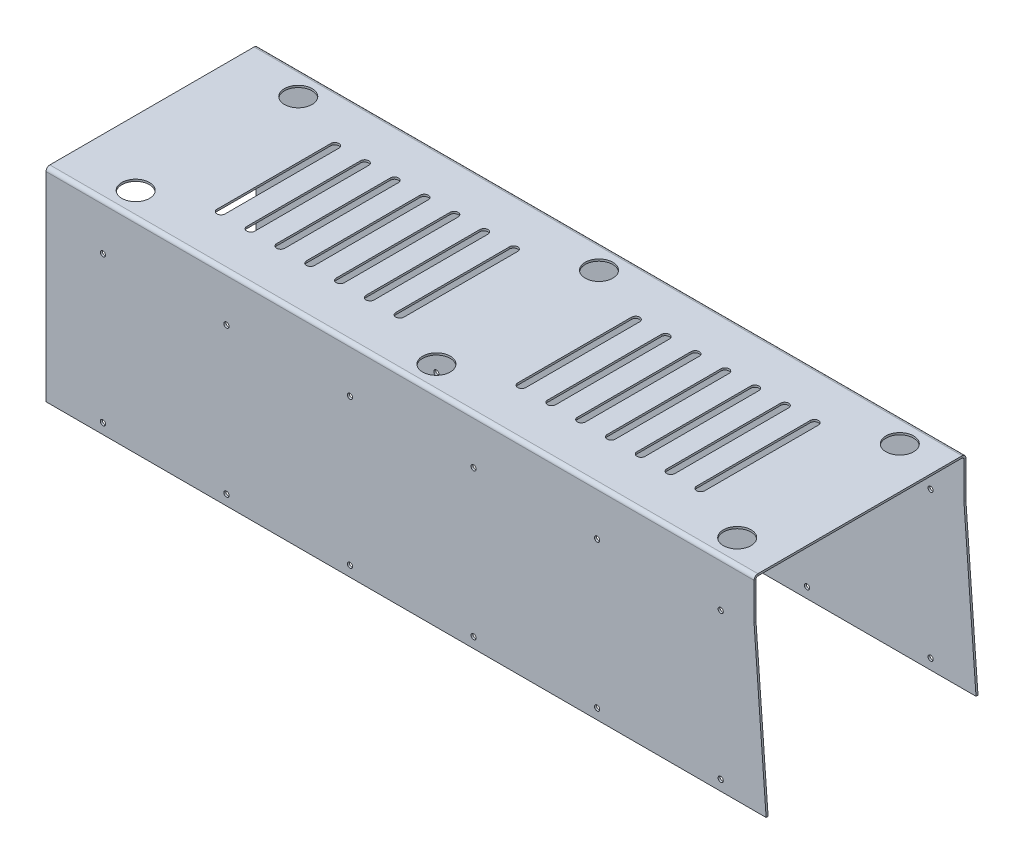
from build123d import *

# Parameters (mm, degrees)
SKETCH1_W               = 450
SKETCH1_H               = 125.6
BOSS_EXTRUDE1_DEPTH     = 1.22
EDGE_FLANGE1_DEPTH      = 450
EDGE_FLANGE1_BEND_DEPTH = 450
CUT_EXTRUDE1_DEPTH      = 265.939058972
CUT_EXTRUDE1_DEPTH_BACK = 265.939058972
CUT_EXTRUDE4_REACH      = 267.511
SKETCH15_R              = 8.5
CUT_EXTRUDE5_DEPTH      = 265.939058972
CUT_EXTRUDE5_DEPTH_BACK = 265.939058972
SKETCH16_R              = 1.6
CUT_EXTRUDE6_REACH      = 267.511


# Sheet-metal steps are written as plain solids
with BuildPart() as part:
    # Sketch1 → Boss-Extrude1 (new body)
    with BuildSketch(Plane(origin=(0, 0, 0), x_dir=(1, 0, 0), z_dir=(0, 1, 0))):
        Rectangle(SKETCH1_W, SKETCH1_H)
    extrude(amount=BOSS_EXTRUDE1_DEPTH)

    # Edge-Flange1 section (across the edge) → Edge-Flange1 (add)
    with BuildSketch(Plane(origin=(225, 0, 63.943), x_dir=(0, 0, -1), z_dir=(-1, 0, 0))):
        with BuildLine():
            Line((-1.22, 1.143), (-1.22, 123.78))
            Line((-1.22, 123.78), (0, 123.78))
            Line((0, 123.78), (0, 1.143))
            ThreePointArc((0, 1.143), (0.334776949, 0.334776949), (1.143, 0))
            Line((1.143, 0), (1.143, -1.22))
            ThreePointArc((1.143, -1.22), (-0.527893324, -0.527893324), (-1.22, 1.143))
        make_face()
    extrude(amount=EDGE_FLANGE1_DEPTH)

    # Edge-Flange1 section 2 (across the edge) → Edge-Flange1 bend (add)
    with BuildSketch(Plane(origin=(-225, 0, -63.943), x_dir=(0, 0, 1), z_dir=(1, 0, 0))):
        with BuildLine():
            Line((-1.22, 1.143), (-1.22, 123.78))
            Line((-1.22, 123.78), (0, 123.78))
            Line((0, 123.78), (0, 1.143))
            ThreePointArc((0, 1.143), (0.334776949, 0.334776949), (1.143, 0))
            Line((1.143, 0), (1.143, -1.22))
            ThreePointArc((1.143, -1.22), (-0.527893324, -0.527893324), (-1.22, 1.143))
        make_face()
    extrude(amount=EDGE_FLANGE1_BEND_DEPTH)

    # Sketch12 → Cut-Extrude1 (cut, two sides: drawn at the far end of the back side and taken through both)
    with BuildSketch(Plane.XY.offset(-CUT_EXTRUDE1_DEPTH_BACK)):
        Polygon((225, -218.78), (225, -243.78), (235.508996835, -243.78), (235.508996835, 1.22), (210.508996835, 1.22), (210.508996835, -23.78), align=None)
    extrude(amount=CUT_EXTRUDE1_DEPTH + CUT_EXTRUDE1_DEPTH_BACK, mode=Mode.SUBTRACT)

    # Sketch15 → Cut-Extrude4 (cut, up to next)
    with BuildSketch(Plane(origin=(0, 1.22, 0), x_dir=(1, 0, 0), z_dir=(0, 1, 0)), mode=Mode.PRIVATE) as cut_extrude4_sk1:
        with Locations(Location((185, 50, 0), (0, 0, 270))):
            Circle(SKETCH15_R)
    cut_extrude4_tool1 = extrude(cut_extrude4_sk1.sketch, amount=-CUT_EXTRUDE4_REACH, mode=Mode.PRIVATE) & part.part
    # Sketch15 → Cut-Extrude4 (cut, up to next)
    with BuildSketch(Plane(origin=(0, 1.22, 0), x_dir=(1, 0, 0), z_dir=(0, 1, 0)), mode=Mode.PRIVATE) as cut_extrude4_sk2:
        with Locations(Location((-185, 50, 0), (0, 0, 270))):
            Circle(SKETCH15_R)
    cut_extrude4_tool2 = extrude(cut_extrude4_sk2.sketch, amount=-CUT_EXTRUDE4_REACH, mode=Mode.PRIVATE) & part.part
    # Sketch15 → Cut-Extrude4 (cut, up to next)
    with BuildSketch(Plane(origin=(0, 1.22, 0), x_dir=(1, 0, 0), z_dir=(0, 1, 0)), mode=Mode.PRIVATE) as cut_extrude4_sk3:
        with Locations(Location((-185, -50, 0), (0, 0, 270))):
            Circle(SKETCH15_R)
    cut_extrude4_tool3 = extrude(cut_extrude4_sk3.sketch, amount=-CUT_EXTRUDE4_REACH, mode=Mode.PRIVATE) & part.part
    # Sketch15 → Cut-Extrude4 (cut, up to next)
    with BuildSketch(Plane(origin=(0, 1.22, 0), x_dir=(1, 0, 0), z_dir=(0, 1, 0)), mode=Mode.PRIVATE) as cut_extrude4_sk4:
        with Locations(Location((185, -50, 0), (0, 0, 270))):
            Circle(SKETCH15_R)
    cut_extrude4_tool4 = extrude(cut_extrude4_sk4.sketch, amount=-CUT_EXTRUDE4_REACH, mode=Mode.PRIVATE) & part.part
    # Sketch15 → Cut-Extrude4 (cut, up to next)
    with BuildSketch(Plane(origin=(0, 1.22, 0), x_dir=(1, 0, 0), z_dir=(0, 1, 0)), mode=Mode.PRIVATE) as cut_extrude4_sk5:
        with Locations(Location((0, 50, 0), (0, 0, 270))):
            Circle(SKETCH15_R)
    cut_extrude4_tool5 = extrude(cut_extrude4_sk5.sketch, amount=-CUT_EXTRUDE4_REACH, mode=Mode.PRIVATE) & part.part
    # Sketch15 → Cut-Extrude4 (cut, up to next)
    with BuildSketch(Plane(origin=(0, 1.22, 0), x_dir=(1, 0, 0), z_dir=(0, 1, 0)), mode=Mode.PRIVATE) as cut_extrude4_sk6:
        with Locations(Location((0, -50, 0), (0, 0, 270))):
            Circle(SKETCH15_R)
    cut_extrude4_tool6 = extrude(cut_extrude4_sk6.sketch, amount=-CUT_EXTRUDE4_REACH, mode=Mode.PRIVATE) & part.part
    add(cut_extrude4_tool1.solids().sort_by_distance((185, 1.22, -50))[0], mode=Mode.SUBTRACT)
    add(cut_extrude4_tool2.solids().sort_by_distance((-185, 1.22, -50))[0], mode=Mode.SUBTRACT)
    add(cut_extrude4_tool3.solids().sort_by_distance((-185, 1.22, 50))[0], mode=Mode.SUBTRACT)
    add(cut_extrude4_tool4.solids().sort_by_distance((185, 1.22, 50))[0], mode=Mode.SUBTRACT)
    add(cut_extrude4_tool5.solids().sort_by_distance((0, 1.22, -50))[0], mode=Mode.SUBTRACT)
    add(cut_extrude4_tool6.solids().sort_by_distance((0, 1.22, 50))[0], mode=Mode.SUBTRACT)

    # Sketch16 → Cut-Extrude5 (cut, two sides: drawn at the far end of the back side and taken through both)
    with BuildSketch(Plane.XY.offset(-CUT_EXTRUDE5_DEPTH_BACK)):
        with Locations((-190, -27.4)):
            Circle(SKETCH16_R)
        with Locations((-114, -27.4)):
            Circle(SKETCH16_R)
        with Locations((-38, -27.4)):
            Circle(SKETCH16_R)
        with Locations((38, -27.4)):
            Circle(SKETCH16_R)
        with Locations((114, -27.4)):
            Circle(SKETCH16_R)
        with Locations((190, -27.4)):
            Circle(SKETCH16_R)
        with Locations((190, -117.4)):
            Circle(SKETCH16_R)
        with Locations((114, -117.4)):
            Circle(SKETCH16_R)
        with Locations((38, -117.4)):
            Circle(SKETCH16_R)
        with Locations((-38, -117.4)):
            Circle(SKETCH16_R)
        with Locations((-114, -117.46)):
            Circle(SKETCH16_R)
        with Locations((-190, -117.4)):
            Circle(SKETCH16_R)
    extrude(amount=CUT_EXTRUDE5_DEPTH + CUT_EXTRUDE5_DEPTH_BACK, mode=Mode.SUBTRACT)

    # Sketch17 → Cut-Extrude6 (cut, up to next)
    with BuildSketch(Plane(origin=(0, 1.22, 0), x_dir=(1, 0, 0), z_dir=(0, 1, 0)), mode=Mode.PRIVATE) as cut_extrude6_sk1:
        with BuildLine():
            Line((-150, -35), (-150, 35))
            ThreePointArc((-150, 35), (-147.5, 37.5), (-145, 35))
            Line((-145, 35), (-145, -35))
            ThreePointArc((-145, -35), (-147.5, -37.5), (-150, -35))
        make_face()
    cut_extrude6_tool1 = extrude(cut_extrude6_sk1.sketch, amount=-CUT_EXTRUDE6_REACH, mode=Mode.PRIVATE) & part.part
    # Sketch17 → Cut-Extrude6 (cut, up to next)
    with BuildSketch(Plane(origin=(0, 1.22, 0), x_dir=(1, 0, 0), z_dir=(0, 1, 0)), mode=Mode.PRIVATE) as cut_extrude6_sk2:
        with BuildLine():
            Line((-126.666666667, -35), (-126.666666667, 35))
            ThreePointArc((-126.666666667, 35), (-129.166666667, 37.5), (-131.666666667, 35))
            Line((-131.666666667, 35), (-131.666666667, -35))
            ThreePointArc((-131.666666667, -35), (-129.166666667, -37.5), (-126.666666667, -35))
        make_face()
    cut_extrude6_tool2 = extrude(cut_extrude6_sk2.sketch, amount=-CUT_EXTRUDE6_REACH, mode=Mode.PRIVATE) & part.part
    # Sketch17 → Cut-Extrude6 (cut, up to next)
    with BuildSketch(Plane(origin=(0, 1.22, 0), x_dir=(1, 0, 0), z_dir=(0, 1, 0)), mode=Mode.PRIVATE) as cut_extrude6_sk3:
        with BuildLine():
            Line((-108.333333333, -35), (-108.333333333, 35))
            ThreePointArc((-108.333333333, 35), (-110.833333333, 37.5), (-113.333333333, 35))
            Line((-113.333333333, 35), (-113.333333333, -35))
            ThreePointArc((-113.333333333, -35), (-110.833333333, -37.5), (-108.333333333, -35))
        make_face()
    cut_extrude6_tool3 = extrude(cut_extrude6_sk3.sketch, amount=-CUT_EXTRUDE6_REACH, mode=Mode.PRIVATE) & part.part
    # Sketch17 → Cut-Extrude6 (cut, up to next)
    with BuildSketch(Plane(origin=(0, 1.22, 0), x_dir=(1, 0, 0), z_dir=(0, 1, 0)), mode=Mode.PRIVATE) as cut_extrude6_sk4:
        with BuildLine():
            Line((-90, -35), (-90, 35))
            ThreePointArc((-90, 35), (-92.5, 37.5), (-95, 35))
            Line((-95, 35), (-95, -35))
            ThreePointArc((-95, -35), (-92.5, -37.5), (-90, -35))
        make_face()
    cut_extrude6_tool4 = extrude(cut_extrude6_sk4.sketch, amount=-CUT_EXTRUDE6_REACH, mode=Mode.PRIVATE) & part.part
    # Sketch17 → Cut-Extrude6 (cut, up to next)
    with BuildSketch(Plane(origin=(0, 1.22, 0), x_dir=(1, 0, 0), z_dir=(0, 1, 0)), mode=Mode.PRIVATE) as cut_extrude6_sk5:
        with BuildLine():
            Line((-71.666666667, -35), (-71.666666667, 35))
            ThreePointArc((-71.666666667, 35), (-74.166666667, 37.5), (-76.666666667, 35))
            Line((-76.666666667, 35), (-76.666666667, -35))
            ThreePointArc((-76.666666667, -35), (-74.166666667, -37.5), (-71.666666667, -35))
        make_face()
    cut_extrude6_tool5 = extrude(cut_extrude6_sk5.sketch, amount=-CUT_EXTRUDE6_REACH, mode=Mode.PRIVATE) & part.part
    # Sketch17 → Cut-Extrude6 (cut, up to next)
    with BuildSketch(Plane(origin=(0, 1.22, 0), x_dir=(1, 0, 0), z_dir=(0, 1, 0)), mode=Mode.PRIVATE) as cut_extrude6_sk6:
        with BuildLine():
            Line((-53.333333333, -35), (-53.333333333, 35))
            ThreePointArc((-53.333333333, 35), (-55.833333333, 37.5), (-58.333333333, 35))
            Line((-58.333333333, 35), (-58.333333333, -35))
            ThreePointArc((-58.333333333, -35), (-55.833333333, -37.5), (-53.333333333, -35))
        make_face()
    cut_extrude6_tool6 = extrude(cut_extrude6_sk6.sketch, amount=-CUT_EXTRUDE6_REACH, mode=Mode.PRIVATE) & part.part
    # Sketch17 → Cut-Extrude6 (cut, up to next)
    with BuildSketch(Plane(origin=(0, 1.22, 0), x_dir=(1, 0, 0), z_dir=(0, 1, 0)), mode=Mode.PRIVATE) as cut_extrude6_sk7:
        with BuildLine():
            Line((-35, -35), (-35, 35))
            ThreePointArc((-35, 35), (-37.5, 37.5), (-40, 35))
            Line((-40, 35), (-40, -35))
            ThreePointArc((-40, -35), (-37.5, -37.5), (-35, -35))
        make_face()
    cut_extrude6_tool7 = extrude(cut_extrude6_sk7.sketch, amount=-CUT_EXTRUDE6_REACH, mode=Mode.PRIVATE) & part.part
    # Sketch17 → Cut-Extrude6 (cut, up to next)
    with BuildSketch(Plane(origin=(0, 1.22, 0), x_dir=(1, 0, 0), z_dir=(0, 1, 0)), mode=Mode.PRIVATE) as cut_extrude6_sk8:
        with BuildLine():
            Line((150, -35), (150, 35))
            ThreePointArc((150, 35), (147.5, 37.5), (145, 35))
            Line((145, 35), (145, -35))
            ThreePointArc((145, -35), (147.5, -37.5), (150, -35))
        make_face()
    cut_extrude6_tool8 = extrude(cut_extrude6_sk8.sketch, amount=-CUT_EXTRUDE6_REACH, mode=Mode.PRIVATE) & part.part
    # Sketch17 → Cut-Extrude6 (cut, up to next)
    with BuildSketch(Plane(origin=(0, 1.22, 0), x_dir=(1, 0, 0), z_dir=(0, 1, 0)), mode=Mode.PRIVATE) as cut_extrude6_sk9:
        with BuildLine():
            Line((131.666666667, -35), (131.666666667, 35))
            ThreePointArc((131.666666667, 35), (129.166666667, 37.5), (126.666666667, 35))
            Line((126.666666667, 35), (126.666666667, -35))
            ThreePointArc((126.666666667, -35), (129.166666667, -37.5), (131.666666667, -35))
        make_face()
    cut_extrude6_tool9 = extrude(cut_extrude6_sk9.sketch, amount=-CUT_EXTRUDE6_REACH, mode=Mode.PRIVATE) & part.part
    # Sketch17 → Cut-Extrude6 (cut, up to next)
    with BuildSketch(Plane(origin=(0, 1.22, 0), x_dir=(1, 0, 0), z_dir=(0, 1, 0)), mode=Mode.PRIVATE) as cut_extrude6_sk10:
        with BuildLine():
            Line((113.333333333, -35), (113.333333333, 35))
            ThreePointArc((113.333333333, 35), (110.833333333, 37.5), (108.333333333, 35))
            Line((108.333333333, 35), (108.333333333, -35))
            ThreePointArc((108.333333333, -35), (110.833333333, -37.5), (113.333333333, -35))
        make_face()
    cut_extrude6_tool10 = extrude(cut_extrude6_sk10.sketch, amount=-CUT_EXTRUDE6_REACH, mode=Mode.PRIVATE) & part.part
    # Sketch17 → Cut-Extrude6 (cut, up to next)
    with BuildSketch(Plane(origin=(0, 1.22, 0), x_dir=(1, 0, 0), z_dir=(0, 1, 0)), mode=Mode.PRIVATE) as cut_extrude6_sk11:
        with BuildLine():
            Line((95, -35), (95, 35))
            ThreePointArc((95, 35), (92.5, 37.5), (90, 35))
            Line((90, 35), (90, -35))
            ThreePointArc((90, -35), (92.5, -37.5), (95, -35))
        make_face()
    cut_extrude6_tool11 = extrude(cut_extrude6_sk11.sketch, amount=-CUT_EXTRUDE6_REACH, mode=Mode.PRIVATE) & part.part
    # Sketch17 → Cut-Extrude6 (cut, up to next)
    with BuildSketch(Plane(origin=(0, 1.22, 0), x_dir=(1, 0, 0), z_dir=(0, 1, 0)), mode=Mode.PRIVATE) as cut_extrude6_sk12:
        with BuildLine():
            Line((76.666666667, -35), (76.666666667, 35))
            ThreePointArc((76.666666667, 35), (74.166666667, 37.5), (71.666666667, 35))
            Line((71.666666667, 35), (71.666666667, -35))
            ThreePointArc((71.666666667, -35), (74.166666667, -37.5), (76.666666667, -35))
        make_face()
    cut_extrude6_tool12 = extrude(cut_extrude6_sk12.sketch, amount=-CUT_EXTRUDE6_REACH, mode=Mode.PRIVATE) & part.part
    # Sketch17 → Cut-Extrude6 (cut, up to next)
    with BuildSketch(Plane(origin=(0, 1.22, 0), x_dir=(1, 0, 0), z_dir=(0, 1, 0)), mode=Mode.PRIVATE) as cut_extrude6_sk13:
        with BuildLine():
            Line((58.333333333, -35), (58.333333333, 35))
            ThreePointArc((58.333333333, 35), (55.833333333, 37.5), (53.333333333, 35))
            Line((53.333333333, 35), (53.333333333, -35))
            ThreePointArc((53.333333333, -35), (55.833333333, -37.5), (58.333333333, -35))
        make_face()
    cut_extrude6_tool13 = extrude(cut_extrude6_sk13.sketch, amount=-CUT_EXTRUDE6_REACH, mode=Mode.PRIVATE) & part.part
    # Sketch17 → Cut-Extrude6 (cut, up to next)
    with BuildSketch(Plane(origin=(0, 1.22, 0), x_dir=(1, 0, 0), z_dir=(0, 1, 0)), mode=Mode.PRIVATE) as cut_extrude6_sk14:
        with BuildLine():
            Line((40, -35), (40, 35))
            ThreePointArc((40, 35), (37.5, 37.5), (35, 35))
            Line((35, 35), (35, -35))
            ThreePointArc((35, -35), (37.5, -37.5), (40, -35))
        make_face()
    cut_extrude6_tool14 = extrude(cut_extrude6_sk14.sketch, amount=-CUT_EXTRUDE6_REACH, mode=Mode.PRIVATE) & part.part
    add(cut_extrude6_tool1.solids().sort_by_distance((-147.5, 1.22, 0))[0], mode=Mode.SUBTRACT)
    add(cut_extrude6_tool2.solids().sort_by_distance((-129.166667, 1.22, 0))[0], mode=Mode.SUBTRACT)
    add(cut_extrude6_tool3.solids().sort_by_distance((-110.833333, 1.22, 0))[0], mode=Mode.SUBTRACT)
    add(cut_extrude6_tool4.solids().sort_by_distance((-92.5, 1.22, 0))[0], mode=Mode.SUBTRACT)
    add(cut_extrude6_tool5.solids().sort_by_distance((-74.166667, 1.22, 0))[0], mode=Mode.SUBTRACT)
    add(cut_extrude6_tool6.solids().sort_by_distance((-55.833333, 1.22, 0))[0], mode=Mode.SUBTRACT)
    add(cut_extrude6_tool7.solids().sort_by_distance((-37.5, 1.22, 0))[0], mode=Mode.SUBTRACT)
    add(cut_extrude6_tool8.solids().sort_by_distance((147.5, 1.22, 0))[0], mode=Mode.SUBTRACT)
    add(cut_extrude6_tool9.solids().sort_by_distance((129.166667, 1.22, 0))[0], mode=Mode.SUBTRACT)
    add(cut_extrude6_tool10.solids().sort_by_distance((110.833333, 1.22, 0))[0], mode=Mode.SUBTRACT)
    add(cut_extrude6_tool11.solids().sort_by_distance((92.5, 1.22, 0))[0], mode=Mode.SUBTRACT)
    add(cut_extrude6_tool12.solids().sort_by_distance((74.166667, 1.22, 0))[0], mode=Mode.SUBTRACT)
    add(cut_extrude6_tool13.solids().sort_by_distance((55.833333, 1.22, 0))[0], mode=Mode.SUBTRACT)
    add(cut_extrude6_tool14.solids().sort_by_distance((37.5, 1.22, 0))[0], mode=Mode.SUBTRACT)


solid = part.part
